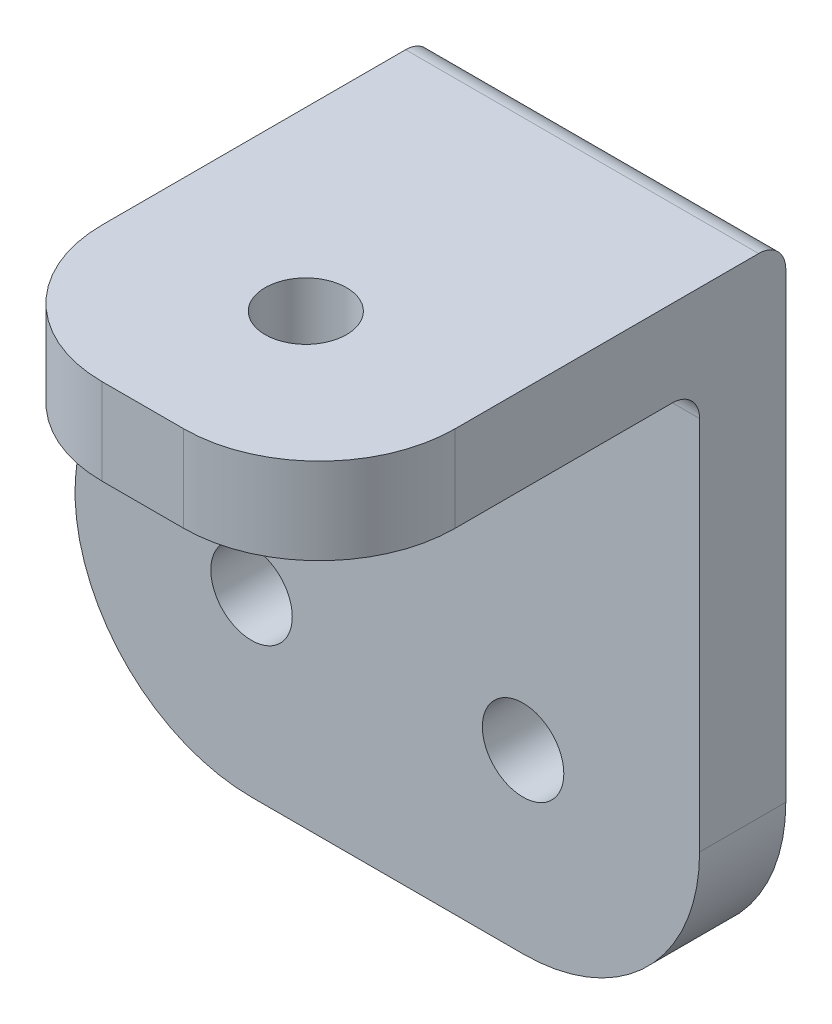
from build123d import *

# Parameters (mm, degrees)
SKETCH1_R               = 6.5
SKETCH1_R_2             = 1.5
BOSS_EXTRUDE1_DEPTH     = 3.175
SKETCH2_W               = 13
SKETCH2_H               = 3.175
BOSS_EXTRUDE2_DEPTH     = 14
SKETCH3_R               = 1.5
CUT_EXTRUDE1_DEPTH      = 18
FILLET1_R               = 5
BOSS_EXTRUDE3_START     = -3.175
BOSS_EXTRUDE3_OUTLINE_R = 1.5
BOSS_EXTRUDE3_DEPTH     = 3.175
FILLET3_R               = 1
CHAMFER1_SIZE           = 5


with BuildPart() as part:
    # Sketch1 → Boss-Extrude1 (new body)
    # profile 1 of 2: a face of its own
    with BuildSketch(Plane.XY):
        Circle(SKETCH1_R)
        Circle(SKETCH1_R_2, mode=Mode.SUBTRACT)
    # profile 2 of 2: a face of its own
    with BuildSketch(Plane.XY):
        with BuildLine():
            Line((-6.5, 18), (-6.5, 0))
            ThreePointArc((-6.5, 0), (0, 6.5), (6.5, 0))
            Line((6.5, 0), (6.5, 18))
            Line((6.5, 18), (-6.5, 18))
        make_face()
    extrude(amount=BOSS_EXTRUDE1_DEPTH)

    # Sketch2 → Boss-Extrude2 (add)
    with BuildSketch(Plane.XY.offset(3.175)):
        with Locations((0, 16.4125)):
            Rectangle(SKETCH2_W, SKETCH2_H)
    extrude(amount=BOSS_EXTRUDE2_DEPTH)

    # Sketch3 → Cut-Extrude1 (cut)
    with BuildSketch(Plane(origin=(0, 18, 0), x_dir=(1, 0, 0), z_dir=(0, 1, 0))):
        with Locations(Location((0, -11.175, 0), (0, 0, 270))):
            Circle(SKETCH3_R)
    extrude(amount=-CUT_EXTRUDE1_DEPTH, mode=Mode.SUBTRACT)

    # Fillet1
    fillet1_edges = [part.edges().sort_by_distance(p)[0] for p in [
        (-6.5, 16.4125, 17.175),
        (6.5, 16.4125, 17.175),
    ]]
    fillet(fillet1_edges, radius=FILLET1_R)

    # Boss-Extrude3: read off the stored shape, not the designer's step
    # Boss-Extrude3 outline → Boss-Extrude3 (add)
    with BuildSketch(Plane(origin=(0, 0, 0), x_dir=(-1, 0, 0), z_dir=(0, 0, -1)).offset(BOSS_EXTRUDE3_START)):
        with BuildLine():
            ThreePointArc((6.5, 0), (4.596194078, -4.596194078), (0, -6.5))
            Line((0, -6.5), (10, -6.5))
            ThreePointArc((10, -6.5), (16.239069091, 1.823188658), (6.5, 5.477225575))
            Line((6.5, 5.477225575), (6.5, 0))
        make_face()
        with Locations((10, 0)):
            Circle(BOSS_EXTRUDE3_OUTLINE_R, mode=Mode.SUBTRACT)
    extrude(amount=BOSS_EXTRUDE3_DEPTH)

    # Fillet3
    fillet3_edges = [part.edges().sort_by_distance(p)[0] for p in [
        (0, 14.825, 3.175),
        (0, 18, 0),
    ]]
    fillet(fillet3_edges, radius=FILLET3_R)

    # Chamfer1
    # the kernel refuses this chamfer: 5, 3.62027218 mm, written as the material it adds along each edge
    with BuildSketch(Plane(origin=(-6.5, 5.477225575, 3.175), x_dir=(0, 1, 0), z_dir=(0, 0, -1))) as chamfer1_piece_1:
        with BuildLine():
            Line((CHAMFER1_SIZE, 0), (1.003807775, -3.996192225))
            ThreePointArc((1.003807775, -3.996192225), (0.840081721, -1.969761939), (0, 0))
            Line((0, 0), (CHAMFER1_SIZE, 0))
        make_face()
    extrude(amount=3.175)


solid = part.part
